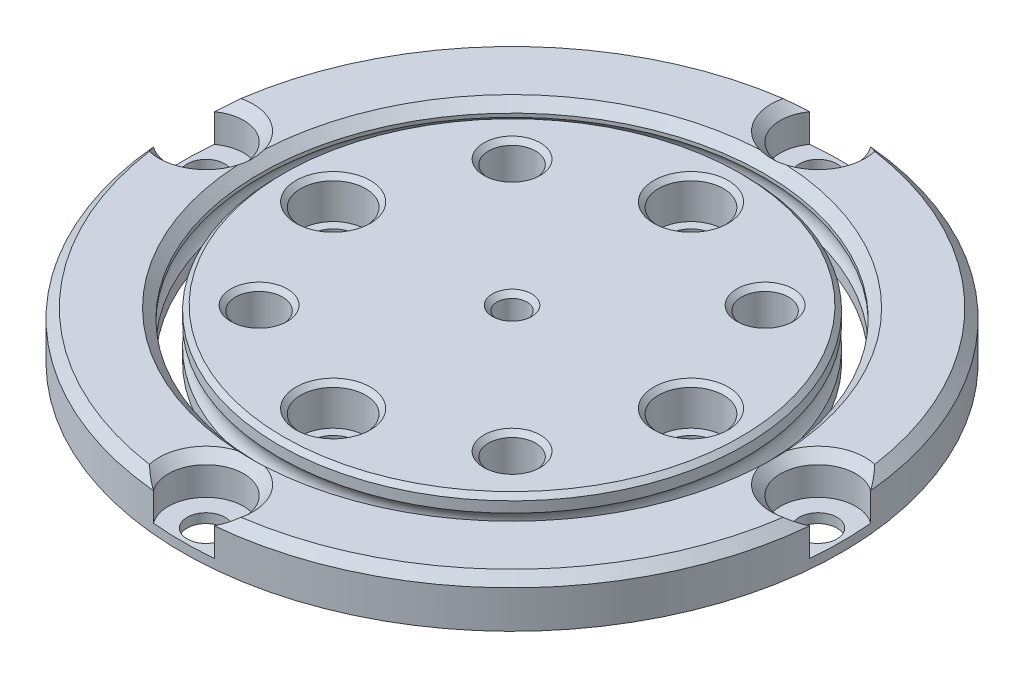
from build123d import *

# Parameters (mm, degrees)
SKETCH2_R           = 23.75
SKETCH2_R_2         = 2.5
SKETCH2_R_3         = 1.5875
BOSS_EXTRUDE2_DEPTH = 5
SKETCH3_R           = 3.45
CUT_EXTRUDE1_DEPTH  = 4
SKETCH5_R           = 2
CUT_EXTRUDE2_DEPTH  = 10
SKETCH6_R           = 4
CUT_EXTRUDE3_DEPTH  = 4
CHAMFER2_SIZE       = 1
SKETCH7_R           = 24.75
SKETCH7_R_2         = 2.5
SKETCH7_R_3         = 1.5875
SKETCH7_R_4         = 3.45
BOSS_EXTRUDE3_DEPTH = 0.25
CHAMFER3_SIZE       = 0.5


with BuildPart() as part:
    # Sketch2 → Boss-Extrude2 (new body)
    with BuildSketch(Plane(origin=(0, 0, 0), x_dir=(-1, 0, 0), z_dir=(0, 1, 0))):
        with Locations(Location((0, 0, 0), (0, 0, 90))):
            Circle(SKETCH2_R)
        with Locations(Location((-13.435028843, 13.435028843, 0), (0, 0, 90))):
            Circle(SKETCH2_R_2, mode=Mode.SUBTRACT)
        with Locations(Location((13.435028843, 13.435028843, 0), (0, 0, 90))):
            Circle(SKETCH2_R_2, mode=Mode.SUBTRACT)
        with Locations(Location((0, 0, 0), (0, 0, 90))):
            Circle(SKETCH2_R_3, mode=Mode.SUBTRACT)
        with Locations(Location((13.435028843, -13.435028843, 0), (0, 0, 90))):
            Circle(SKETCH2_R_2, mode=Mode.SUBTRACT)
        with Locations(Location((0, 19, 0), (0, 0, 90))):
            Circle(SKETCH2_R_2, mode=Mode.SUBTRACT)
        with Locations(Location((19, 0, 0), (0, 0, 90))):
            Circle(SKETCH2_R_2, mode=Mode.SUBTRACT)
        with Locations(Location((0, -19, 0), (0, 0, 90))):
            Circle(SKETCH2_R_2, mode=Mode.SUBTRACT)
        with Locations(Location((-19, 0, 0), (0, 0, 90))):
            Circle(SKETCH2_R_2, mode=Mode.SUBTRACT)
        with Locations(Location((-13.435028843, -13.435028843, 0), (0, 0, 90))):
            Circle(SKETCH2_R_2, mode=Mode.SUBTRACT)
    extrude(amount=-BOSS_EXTRUDE2_DEPTH)

    # Sketch3 → Cut-Extrude1 (cut)
    with BuildSketch(Plane(origin=(0, 0, 0), x_dir=(1, 0, 0), z_dir=(0, 1, 0))):
        with Locations(Location((0, 19, 0), (0, 0, 270))):
            Circle(SKETCH3_R)
        with Locations(Location((19, 0, 0), (0, 0, 270))):
            Circle(SKETCH3_R)
        with Locations(Location((0, -19, 0), (0, 0, 270))):
            Circle(SKETCH3_R)
        with Locations(Location((-19, 0, 0), (0, 0, 270))):
            Circle(SKETCH3_R)
    extrude(amount=-CUT_EXTRUDE1_DEPTH, mode=Mode.SUBTRACT)

    # Sketch4 → Revolve1 (revolve)
    with BuildSketch(Plane.XY, mode=Mode.PRIVATE) as revolve1_sk:
        with BuildLine():
            Line((-24.75, 0), (-23.75, 0))
            Line((-23.75, 0), (-23.75, -5))
            Line((-23.75, -5), (-24.75, -5))
            Line((-24.75, -5), (-24.75, -3.618033989))
            ThreePointArc((-24.75, -3.618033989), (-24.25, -2.5), (-24.75, -1.381966011))
            Line((-24.75, -1.381966011), (-24.75, 0))
        make_face()
        with BuildLine():
            Line((-26.75, -5), (-26.75, -3.618033989))
            ThreePointArc((-26.75, -3.618033989), (-27.25, -2.5), (-26.75, -1.381966011))
            Line((-26.75, -1.381966011), (-26.75, 0))
            Line((-26.75, 0), (-35, 0))
            Line((-35, 0), (-35, -5))
            Line((-35, -5), (-26.75, -5))
        make_face()
    revolve(revolve1_sk.sketch.rotate(Axis((0, -2.5, 0), (0, 1, 0)), 270), axis=Axis((0, -2.5, 0), (0, 1, 0)))


with BuildPart() as revolve1_piece_1:
    # of the separate pieces the step leaves, piece 1, a body of its own (revolve1_pieces)
    add(part.part.solids().sort_by_distance((13.435028843, 0, -10.935028843))[0])

    # Sketch7 → Boss-Extrude3 (add)
    with BuildSketch(Plane(origin=(0, 0, 0), x_dir=(1, 0, 0), z_dir=(0, 1, 0))):
        with Locations(Location((0, 0, 0), (0, 0, 90))):
            Circle(SKETCH7_R)
        with Locations(Location((13.435028843, 13.435028843, 0), (0, 0, 270))):
            Circle(SKETCH7_R_2, mode=Mode.SUBTRACT)
        with Locations(Location((-13.435028843, 13.435028843, 0), (0, 0, 270))):
            Circle(SKETCH7_R_2, mode=Mode.SUBTRACT)
        with Locations(Location((0, 0, 0), (0, 0, 270))):
            Circle(SKETCH7_R_3, mode=Mode.SUBTRACT)
        with Locations(Location((-13.435028843, -13.435028843, 0), (0, 0, 270))):
            Circle(SKETCH7_R_2, mode=Mode.SUBTRACT)
        with Locations(Location((13.435028843, -13.435028843, 0), (0, 0, 270))):
            Circle(SKETCH7_R_2, mode=Mode.SUBTRACT)
        with Locations(Location((-19, 0, 0), (0, 0, 270))):
            Circle(SKETCH7_R_4, mode=Mode.SUBTRACT)
        with Locations(Location((0, -19, 0), (0, 0, 270))):
            Circle(SKETCH7_R_4, mode=Mode.SUBTRACT)
        with Locations(Location((19, 0, 0), (0, 0, 270))):
            Circle(SKETCH7_R_4, mode=Mode.SUBTRACT)
        with Locations(Location((0, 19, 0), (0, 0, 270))):
            Circle(SKETCH7_R_4, mode=Mode.SUBTRACT)
    extrude(amount=BOSS_EXTRUDE3_DEPTH)

    # Chamfer3
    chamfer3_edges = [revolve1_piece_1.edges().sort_by_distance(p)[0] for p in [
        (0, 0.25, 24.75),
        (13.435028843, 0.25, -15.935028843),
        (-13.435028843, 0.25, -15.935028843),
        (0, 0.25, -1.5875),
        (-13.435028843, 0.25, 10.935028843),
        (13.435028843, 0.25, 10.935028843),
        (-19, 0.25, -3.45),
        (0, 0.25, 15.55),
        (19, 0.25, -3.45),
        (0, 0.25, -22.45),
    ]]
    chamfer(chamfer3_edges, length=CHAMFER3_SIZE)


with BuildPart() as revolve1_piece_2:
    # of the separate pieces the step leaves, piece 2, a body of its own (revolve1_pieces)
    add(part.part.solids().sort_by_distance((0, -5, -26.75))[0])

    # Sketch5 → Cut-Extrude2 (cut)
    with BuildSketch(Plane(origin=(0, 0, 0), x_dir=(1, 0, 0), z_dir=(0, 1, 0))):
        with Locations(Location((0, 32.5, 0), (0, 0, 270))):
            Circle(SKETCH5_R)
        with Locations(Location((32.5, 0, 0), (0, 0, 270))):
            Circle(SKETCH5_R)
        with Locations(Location((0, -32.5, 0), (0, 0, 270))):
            Circle(SKETCH5_R)
        with Locations(Location((-32.5, 0, 0), (0, 0, 270))):
            Circle(SKETCH5_R)
    extrude(amount=-CUT_EXTRUDE2_DEPTH, mode=Mode.SUBTRACT)

    # Sketch6 → Cut-Extrude3 (cut)
    with BuildSketch(Plane(origin=(0, 0, 0), x_dir=(1, 0, 0), z_dir=(0, 1, 0))):
        with Locations((0, -32.5)):
            Circle(SKETCH6_R)
        with Locations((-32.5, 0)):
            Circle(SKETCH6_R)
        with Locations((0, 32.5)):
            Circle(SKETCH6_R)
        with Locations((32.5, 0)):
            Circle(SKETCH6_R)
    extrude(amount=-CUT_EXTRUDE3_DEPTH, mode=Mode.SUBTRACT)

    # Chamfer2
    # the kernel refuses this chamfer: 1 mm, written as the material it takes off along each edge
    with BuildSketch(Plane(origin=(0, 0, 0), x_dir=(0.019114321981189532, 0, 0.9998173046588058), z_dir=(-0.9998173046588058, 0, 0.019114321981189532))) as chamfer2_piece_1:
        Polygon((35 - CHAMFER2_SIZE, 0), (35, -CHAMFER2_SIZE), (35, 0), align=None)
    revolve(axis=Axis((0, 0, 0), (0, 1, 0)), revolution_arc=87.809526646, mode=Mode.SUBTRACT)
    with BuildSketch(Plane(origin=(0, 0, 0), x_dir=(-0.9998173046588067, 0, 0.019114321981147413), z_dir=(-0.019114321981147413, 0, -0.9998173046588067))) as chamfer2_piece_2:
        Polygon((35 - CHAMFER2_SIZE, 0), (35, -CHAMFER2_SIZE), (35, 0), align=None)
    revolve(axis=Axis((0, 0, 0), (0, 1, 0)), revolution_arc=87.809526646, mode=Mode.SUBTRACT)
    with BuildSketch(Plane(origin=(0, 0, 0), x_dir=(-0.019114321981182705, 0, -0.999817304658806), z_dir=(0.999817304658806, 0, -0.019114321981182705))) as chamfer2_piece_3:
        Polygon((35 - CHAMFER2_SIZE, 0), (35, -CHAMFER2_SIZE), (35, 0), align=None)
    revolve(axis=Axis((0, 0, 0), (0, 1, 0)), revolution_arc=87.809526646, mode=Mode.SUBTRACT)
    with BuildSketch(Plane(origin=(0, 0, 32.5), x_dir=(-0.29349569960602556, -1.3653955404004917e-15, 0.9559603936946184), z_dir=(0.9559603936946184, 1.4794691735989965e-15, 0.29349569960602556))) as chamfer2_piece_4:
        Polygon((4 + CHAMFER2_SIZE, 0), (4, CHAMFER2_SIZE), (4, 0), align=None)
    revolve(axis=Axis((0, 0, 32.5), (0, -1, 0)), revolution_arc=325.865290322, mode=Mode.SUBTRACT)
    with BuildSketch(Plane(origin=(-32.5, 0, 0), x_dir=(-0.9559603936947099, -1.386827160904714e-15, -0.2934956996057275), z_dir=(-0.2934956996057275, 7.472387430751279e-15, 0.9559603936947099))) as chamfer2_piece_5:
        Polygon((4 + CHAMFER2_SIZE, 0), (4, CHAMFER2_SIZE), (4, 0), align=None)
    revolve(axis=Axis((-32.5, 0, 0), (0, -1, 0)), revolution_arc=325.865290322, mode=Mode.SUBTRACT)
    with BuildSketch(Plane(origin=(0, 0, 0), x_dir=(0.9998173046588067, 0, -0.0191143219811504), z_dir=(0.0191143219811504, 0, 0.9998173046588067))) as chamfer2_piece_6:
        Polygon((35 - CHAMFER2_SIZE, 0), (35, -CHAMFER2_SIZE), (35, 0), align=None)
    revolve(axis=Axis((0, 0, 0), (0, 1, 0)), revolution_arc=87.809526646, mode=Mode.SUBTRACT)
    with BuildSketch(Plane(origin=(0, 0, -32.5), x_dir=(-0.29349569960600574, -1.3653955404004456e-15, -0.9559603936946244), z_dir=(0.9559603936946244, 1.4794691735989516e-15, -0.29349569960600574))) as chamfer2_piece_7:
        Polygon((4 + CHAMFER2_SIZE, 0), (4, -CHAMFER2_SIZE), (4, 0), align=None)
    revolve(axis=Axis((0, 0, -32.5), (0, 1, 0)), revolution_arc=325.865290322, mode=Mode.SUBTRACT)
    with BuildSketch(Plane(origin=(0, 0, 0), x_dir=(0, 0, -1), z_dir=(1, 0, 0))) as chamfer2_piece_8:
        Polygon((26.75, -CHAMFER2_SIZE), (26.75 + CHAMFER2_SIZE, 0), (26.75, 0), align=None)
    revolve(axis=Axis((0, 0, 0), (0, 1, 0)), mode=Mode.SUBTRACT)
    with BuildSketch(Plane(origin=(32.5, 0, 0), x_dir=(0.9559603936946928, 0, -0.2934956996057833), z_dir=(0.2934956996057833, 0, 0.9559603936946928))) as chamfer2_piece_9:
        Polygon((4 + CHAMFER2_SIZE, 0), (4, -CHAMFER2_SIZE), (4, 0), align=None)
    revolve(axis=Axis((32.5, 0, 0), (0, 1, 0)), revolution_arc=325.865290322, mode=Mode.SUBTRACT)


solid = Compound([revolve1_piece_1.part, revolve1_piece_2.part])
